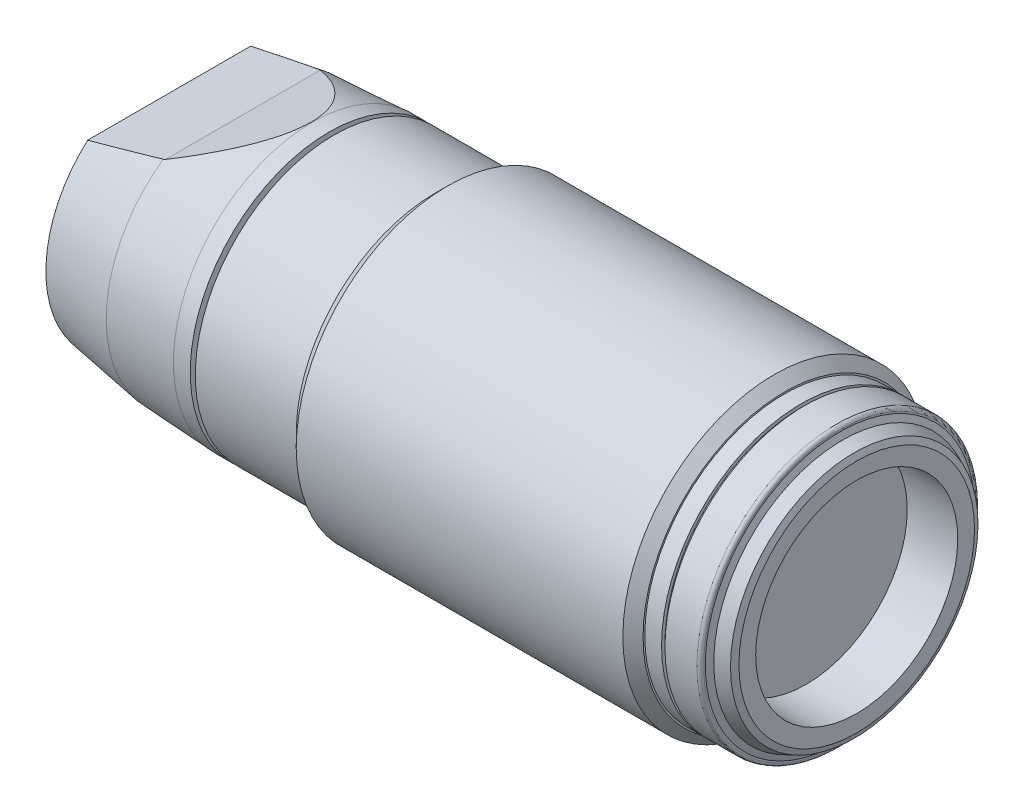
from build123d import *

# Parameters (mm, degrees)
SALIENTE_EXTRUIR1_START             = -7.320816359
SALIENTE_EXTRUIR1_3_DEPTH           = 14.641632718
CROQUIS2_R                          = 8.293601056
SALIENTE_EXTRUIR2_DEPTH             = 0.996962704
CROQUIS3_R                          = 8.094208515
SALIENTE_EXTRUIR3_DEPTH             = 0.199392541
CROQUIS4_R                          = 8.293601056
SALIENTE_EXTRUIR4_DEPTH             = 2.099264862
CROQUIS6_R                          = 7.996393307
SALIENTE_EXTRUIR6_DEPTH             = 0.147505067
SALIENTE_EXTRUIR6_TAPER             = 67.466749921
CROQUIS7_R                          = 7.640868273
SALIENTE_EXTRUIR7_DEPTH             = 0.849457636
SALIENTE_EXTRUIR7_TAPER             = 22.533250079
DI_METRO_DE_TALADRO_12_0_12_1_D     = 12
DI_METRO_DE_TALADRO_12_0_12_1_DEPTH = 3
CHAFL_N1_SIZE                       = 0.598177622
CHAFL_N1_SIZE2                      = 0.601939746
CHAFL_N2_SIZE                       = 0.158849839
CHAFL_N2_SIZE_2                     = 0.292765242
REDONDEO1_R                         = 0.199050823


with BuildPart() as part:
    # Saliente-Extruir1: read off the stored shape, not the designer's step
    # Saliente-Extruir1 outline → Saliente-Extruir1 (revolve)
    with BuildSketch(Plane.YX):
        Polygon((8.99335601, -27.061359261), (0, -27.061359261), (0, -55.101016987), (8.244693452, -55.101016987), (8.244693452, -54.104054283), (7.443361166, -54.104054283), (7.443361166, -53.803084411), (8.244693452, -53.803084411), (8.244693452, -47.810021819), (8.99335601, -47.061359261), align=None)
    revolve(axis=Axis((0, 0, 0), (1, 0, 0)))

    # Saliente-Extruir1 2 outline → Saliente-Extruir1 2 (revolve)
    with BuildSketch(Plane.YX):
        Polygon((0, -55.101016987), (0, -63.6), (7.320816359, -63.6), (8.007236046, -59.33292836), (8.233407082, -55.101016987), align=None)
    revolve(axis=Axis((0, 0, 0), (1, 0, 0)))

    # Saliente-Extruir1 3 outline → Saliente-Extruir1 3 (cut)
    with BuildSketch(Plane.XY.offset(SALIENTE_EXTRUIR1_START)):
        Polygon((-63.6, 5.495125364), (-59.227359982, 6.566499061), (-55.157899775, 8.230367028), (-54, 8.70379403), (-54, 10), (-63.6, 10), align=None)
    extrude(amount=SALIENTE_EXTRUIR1_3_DEPTH, mode=Mode.SUBTRACT)

    # Croquis2 → Saliente-Extruir2 (add)
    with BuildSketch(Plane(origin=(-27.061359261, 0, 0), x_dir=(0, 0, -1), z_dir=(1, 0, 0))):
        Circle(CROQUIS2_R)
    extrude(amount=SALIENTE_EXTRUIR2_DEPTH)

    # Croquis3 → Saliente-Extruir3 (add)
    with BuildSketch(Plane(origin=(-26.064396557, 0, 0), x_dir=(0, 0, -1), z_dir=(1, 0, 0))):
        Circle(CROQUIS3_R)
    extrude(amount=SALIENTE_EXTRUIR3_DEPTH)

    # Croquis4 → Saliente-Extruir4 (add)
    with BuildSketch(Plane(origin=(-25.865004017, 0, 0), x_dir=(0, -1, 0), z_dir=(-1, 0, 0))):
        with Locations(Location((0, 0, 0), (0, 0, 270))):
            Circle(CROQUIS4_R)
    extrude(amount=-SALIENTE_EXTRUIR4_DEPTH)

    # Croquis6 → Saliente-Extruir6 (add)
    with BuildSketch(Plane(origin=(-23.765739154, 0, 0), x_dir=(0, 0, -1), z_dir=(1, 0, 0))):
        Circle(CROQUIS6_R)
    extrude(amount=SALIENTE_EXTRUIR6_DEPTH, taper=SALIENTE_EXTRUIR6_TAPER)

    # Croquis7 → Saliente-Extruir7 (add)
    with BuildSketch(Plane(origin=(-23.618234087, 0, 0), x_dir=(0, 0, -1), z_dir=(1, 0, 0))):
        Circle(CROQUIS7_R)
    extrude(amount=SALIENTE_EXTRUIR7_DEPTH, taper=SALIENTE_EXTRUIR7_TAPER)

    # Diámetro de taladro Ø12.0 (12)1
    with Locations(Plane(origin=(-22.768776451, 0, 0), x_dir=(0, 0, -1), z_dir=(1, 0, 0))):
        with Locations((0, 0)):
            Hole(DI_METRO_DE_TALADRO_12_0_12_1_D / 2, depth=DI_METRO_DE_TALADRO_12_0_12_1_DEPTH)

    # Chaflán1
    chafl_n1_edges = [part.edges().sort_by_distance(p)[0] for p in [
        (-27.061359261, -8.99335601, 0),
    ]]
    chafl_n1_side = [part.faces().sort_by_distance(p)[0] for p in [
        (-27.061359261, -8.738985489, 0),
    ]]
    chamfer(chafl_n1_edges, length=CHAFL_N1_SIZE, length2=CHAFL_N1_SIZE2, reference=chafl_n1_side[0])

    # Chaflán2
    # the kernel refuses this chamfer: 0.292765242, 0.158849839 mm, written as the material it takes off along each edge
    with BuildSketch(Plane(origin=(-22.768776451, 0, 0), x_dir=(0, 0, -1), z_dir=(0, 1, 0))) as chafl_n2_piece_1:
        Polygon((7.288433722 + CHAFL_N2_SIZE * 0.38321951697, CHAFL_N2_SIZE * 0.923657297312), (7.288433722 - CHAFL_N2_SIZE_2, 0), (7.288433722, 0), align=None)
    revolve(axis=Axis((-22.768776451, 0, 0), (-1, 0, 0)), mode=Mode.SUBTRACT)

    # Redondeo1
    redondeo1_edges = [part.edges().sort_by_distance(p)[0] for p in [
        (-23.765739154, 0, 8.293601056),
    ]]
    fillet(redondeo1_edges, radius=REDONDEO1_R)


solid = part.part
